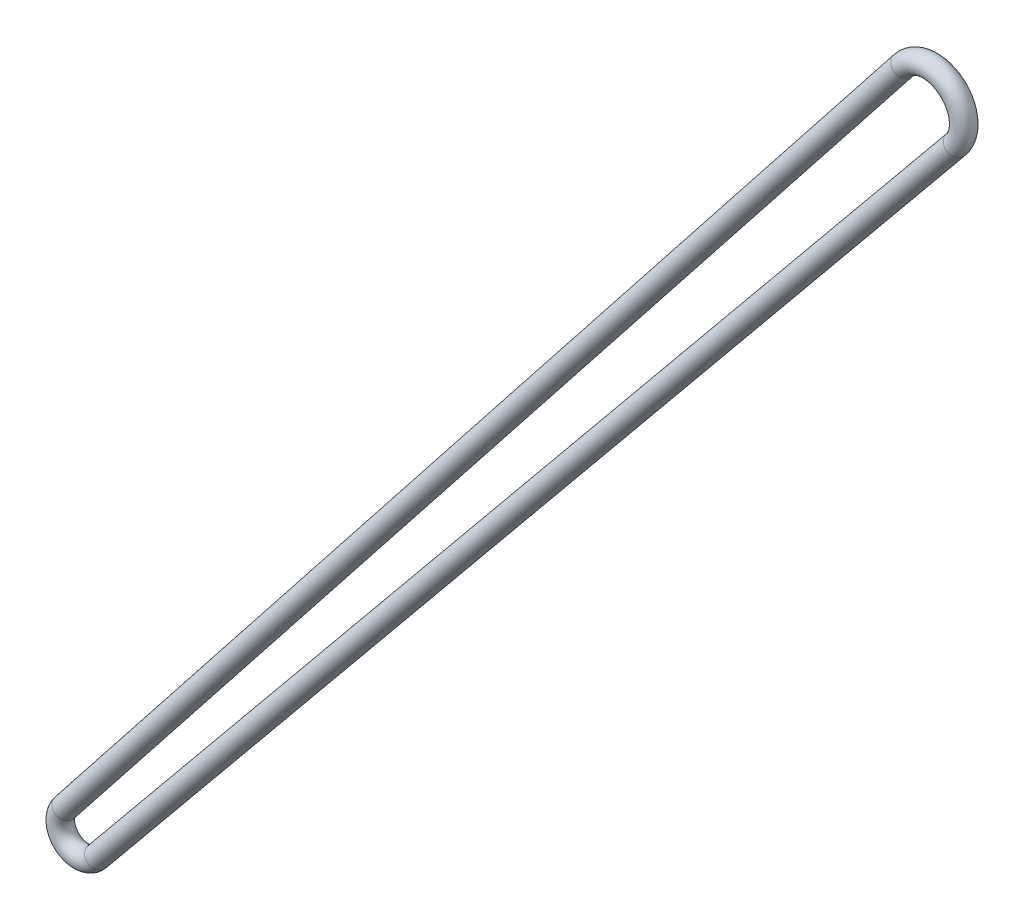
from build123d import *

# Parameters (mm, degrees)
SWEEP_19_PROFILE_R = 1.5


with BuildPart() as part:
    # 扫描19: sweep along a path in 草图2
    with BuildLine(Plane.XY) as sweep_19_path:
        Line((-2.432922765, 1.921165856), (121.989388183, 159.487379939))
        ThreePointArc((121.989388183, 159.487379939), (129.049109223, 160.283306604), (129.778192638, 153.216369659))
        Line((129.778192638, 153.216369659), (2.396135997, -1.966860518))
        ThreePointArc((2.396135997, -1.966860518), (-1.944096196, -2.414634615), (-2.432922765, 1.921165856))
    # 扫描19 profile (on start of the path) → 扫描19 (sweep)
    with BuildSketch(Plane(origin=(-2.432922765, 1.921165856, 0), x_dir=(0.7848150989319116, -0.61972998998636, 0), z_dir=(0.61972998998636, 0.7848150989319116, 0))):
        Circle(SWEEP_19_PROFILE_R)
    sweep(path=sweep_19_path.line)


solid = part.part
